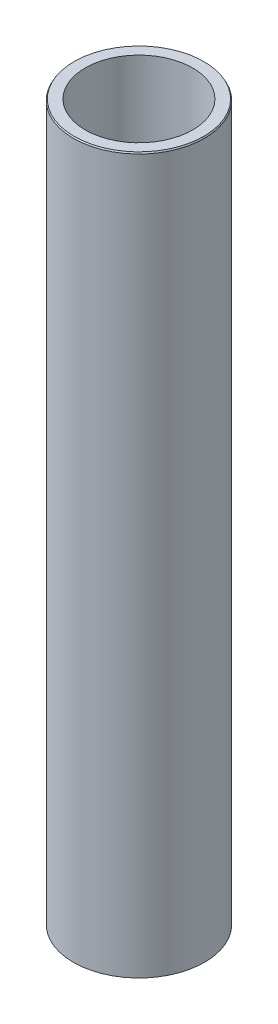
from build123d import *
from OCP.BRepFilletAPI import BRepFilletAPI_MakeChamfer

# Parameters (mm, degrees)
SKETCH1_R           = 55
BOSS_EXTRUDE1_DEPTH = 600
SKETCH2_R           = 45.04995852
CUT_EXTRUDE1_DEPTH  = 606.020660804
CHAMFER1_SIZE       = 1.122508379
CHAMFER1_SIZE2      = 0.648080515


with BuildPart() as part:
    # Sketch1 → Boss-Extrude1 (new body)
    with BuildSketch(Plane(origin=(0, 0, 0), x_dir=(1, 0, 0), z_dir=(0, 1, 0))):
        Circle(SKETCH1_R)
    extrude(amount=BOSS_EXTRUDE1_DEPTH)

    # Sketch2 → Cut-Extrude1 (cut, through all)
    with BuildSketch(Plane(origin=(0, 0, 0), x_dir=(1, 0, 0), z_dir=(0, 1, 0))):
        Circle(SKETCH2_R)
    extrude(amount=CUT_EXTRUDE1_DEPTH, mode=Mode.SUBTRACT)

    # Chamfer1: one chamfer whose edges measure the first distance from different faces: ONE call of the kernel's chamfer builder (chamfer() names one face for all edges)
    chamfer1_edges_1 = [part.edges().sort_by_distance(p)[0] for p in [
        (-55, 600, 0),
    ]]
    chamfer1_side_1 = [part.faces().sort_by_distance(p)[0] for p in [
        (-55, 300, 0),
    ]]
    chamfer1_edges_2 = [part.edges().sort_by_distance(p)[0] for p in [
        (-55, 0, 0),
    ]]
    chamfer1_side_2 = [part.faces().sort_by_distance(p)[0] for p in [
        (-53.444365081, 0, 0),
    ]]
    chamfer1 = BRepFilletAPI_MakeChamfer(part.part.solid().wrapped)
    for e in chamfer1_edges_1:
        chamfer1.Add(CHAMFER1_SIZE, CHAMFER1_SIZE2, e.wrapped, chamfer1_side_1[0].wrapped)  # the first distance lies on this face
    for e in chamfer1_edges_2:
        chamfer1.Add(CHAMFER1_SIZE, CHAMFER1_SIZE2, e.wrapped, chamfer1_side_2[0].wrapped)  # the first distance lies on this face
    add(Compound.cast(chamfer1.Shape()), mode=Mode.REPLACE)


solid = part.part
